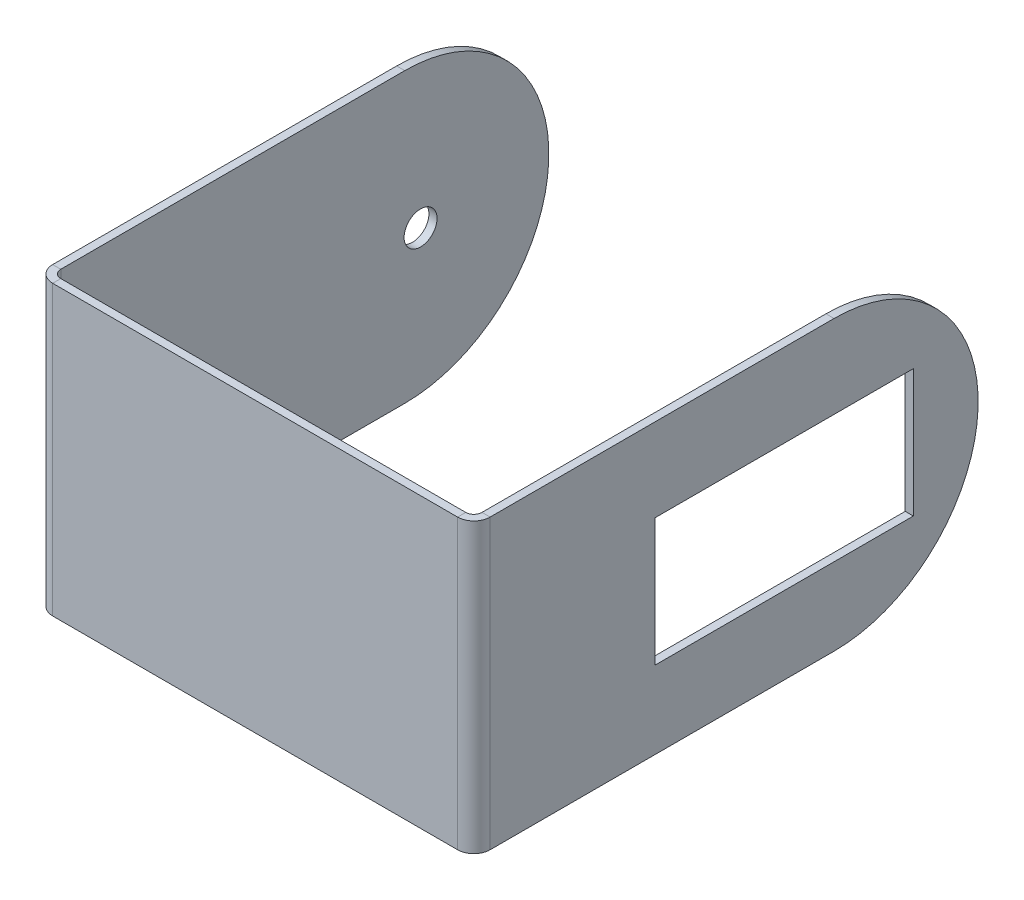
from build123d import *

# Parameters (mm, degrees)
BOSS_EXTRUDE1_DEPTH        = 53.974999999999994
CUT_EXTRUDE1_DEPTH         = 53.974999999999994
CUT_EXTRUDE2_DEPTH         = 40.64
SKETCH4_R                  = 2.0319999999999996
CUT_EXTRUDE3_DEPTH         = 12.699999999999996
CONVERT_SOLID1_DEPTH       = 35.56
CONVERT_SOLID1_START       = 0.640171996
CONVERT_SOLID1_2_OUTLINE_R = 2.032
CONVERT_SOLID1_2_DEPTH     = 0.359828036
CONVERT_SOLID1_START_2     = 52.974999968
CONVERT_SOLID1_3_OUTLINE_W = 15.748000000000001
CONVERT_SOLID1_3_OUTLINE_H = 31.877
CONVERT_SOLID1_3_DEPTH     = 0.241146378
CONVERT_SOLID1_START_3     = 1.000000032
CONVERT_SOLID1_4_OUTLINE_W = 35.56
CONVERT_SOLID1_4_OUTLINE_H = 0.1377071679999986
CONVERT_SOLID1_4_DEPTH     = 51.974999936
CONVERT_SOLID1_5_DEPTH     = 35.56
SCALE1_SCALE               = 1.3


with BuildPart() as part:
    # Sketch1 → Boss-Extrude1 (new body)
    with BuildSketch(Plane(origin=(0, 0, 0), x_dir=(0, 0, -1), z_dir=(1, 0, 0))):
        with BuildLine():
            Line((0, 0), (-44.449999999999996, -5.44e-15))
            Line((-44.449999999999996, -5.44e-15), (-44.449999999999996, 35.55999999999999))
            Line((-44.449999999999996, 35.55999999999999), (0, 35.55999999999999))
            ThreePointArc((0, 35.55999999999999), (17.779999999999994, 17.779999999999994), (0, 0))
        make_face()
    extrude(amount=BOSS_EXTRUDE1_DEPTH)

    # Sketch2 → Cut-Extrude1 (cut)
    with BuildSketch(Plane(origin=(0, 35.55999999999999, 0), x_dir=(1, 0, 0), z_dir=(0, 1, 0))):
        Polygon((0.6401719962352073, 17.998125077829755), (0.6401719962352074, -43.58770713635029), (53.21614634609016, -43.58770713635029), (53.21614634609016, 17.998125077829755), align=None)
    extrude(amount=-CUT_EXTRUDE1_DEPTH, mode=Mode.SUBTRACT)

    # Sketch3 → Cut-Extrude2 (cut)
    with BuildSketch(Plane(origin=(53.974999999999994, 0, 0), x_dir=(0, 0, -1), z_dir=(1, 0, 0))):
        Polygon((-22.098, 25.306389569999986), (9.779, 25.306389569999986), (9.778999999999996, 9.558389569999989), (-22.098, 9.558389569999983), align=None)
    extrude(amount=-CUT_EXTRUDE2_DEPTH, mode=Mode.SUBTRACT)

    # Sketch4 → Cut-Extrude3 (cut)
    with BuildSketch(Plane.ZY):
        with Locations((-1.948939271970541, 17.773350266981094)):
            Circle(SKETCH4_R)
    extrude(amount=-CUT_EXTRUDE3_DEPTH, mode=Mode.SUBTRACT)

    # Convert-Solid1: read off the stored shape, not the designer's step
    # Convert-Solid1 outline → Convert-Solid1 (cut)
    with BuildSketch(Plane(origin=(0, 0, 0), x_dir=(1, 0, 0), z_dir=(0, 1, 0))):
        with BuildLine():
            Line((0, -44.45), (2.000000064, -44.45))
            ThreePointArc((2.000000064, -44.45), (0.585786456, -43.864213544), (0, -42.449999936))
            Line((0, -42.449999936), (0, -44.45))
        make_face()
        with BuildLine():
            Line((53.975, -44.45), (53.975, -42.449999936))
            ThreePointArc((53.975, -42.449999936), (53.389213544, -43.864213544), (51.974999936, -44.45))
            Line((51.974999936, -44.45), (53.975, -44.45))
        make_face()
    extrude(amount=CONVERT_SOLID1_DEPTH, mode=Mode.SUBTRACT)

    # Convert-Solid1 2 outline → Convert-Solid1 2 (add)
    with BuildSketch(Plane.YZ.offset(CONVERT_SOLID1_START)):
        with BuildLine():
            Line((35.56, 43.587707136), (0, 43.587707136))
            Line((0, 43.587707136), (0, 0))
            ThreePointArc((0, 0), (17.78, -17.78), (35.56, 0))
            Line((35.56, 0), (35.56, 43.587707136))
        make_face()
        with Locations((17.773350267, -1.948939272)):
            Circle(CONVERT_SOLID1_2_OUTLINE_R, mode=Mode.SUBTRACT)
    extrude(amount=CONVERT_SOLID1_2_DEPTH)

    # Convert-Solid1 3 outline → Convert-Solid1 3 (add)
    with BuildSketch(Plane.YZ.offset(CONVERT_SOLID1_START_2)):
        with BuildLine():
            Line((35.56, 43.587707136), (0, 43.587707136))
            Line((0, 43.587707136), (0, 0))
            ThreePointArc((0, 0), (17.78, -17.78), (35.56, 0))
            Line((35.56, 0), (35.56, 43.587707136))
        make_face()
        with Locations((17.432389569999998, 6.1594999999999995)):
            Rectangle(CONVERT_SOLID1_3_OUTLINE_W, CONVERT_SOLID1_3_OUTLINE_H, mode=Mode.SUBTRACT)
    extrude(amount=CONVERT_SOLID1_3_DEPTH)

    # Convert-Solid1 4 outline → Convert-Solid1 4 (add)
    with BuildSketch(Plane.YZ.offset(CONVERT_SOLID1_START_3)):
        with Locations((17.78, 43.518853551999996)):
            Rectangle(CONVERT_SOLID1_4_OUTLINE_W, CONVERT_SOLID1_4_OUTLINE_H)
    extrude(amount=CONVERT_SOLID1_4_DEPTH)

    # Convert-Solid1 5 outline → Convert-Solid1 5 (add)
    with BuildSketch(Plane(origin=(0, 0, 0), x_dir=(1, 0, 0), z_dir=(0, 1, 0))):
        with BuildLine():
            Line((1.000000032, -43.449999968), (2.000000064, -43.449999968))
            ThreePointArc((2.000000064, -43.449999968), (1.29289326, -43.15710674), (1.000000032, -42.449999936))
            Line((1.000000032, -42.449999936), (1.000000032, -43.449999968))
        make_face()
        with BuildLine():
            ThreePointArc((52.974999968, -42.449999936), (52.68210674, -43.15710674), (51.974999936, -43.449999968))
            Line((51.974999936, -43.449999968), (52.974999968, -43.449999968))
            Line((52.974999968, -43.449999968), (52.974999968, -42.449999936))
        make_face()
    extrude(amount=CONVERT_SOLID1_5_DEPTH)


with BuildPart() as part_1:
    # Scale1: scaled about (24.607246438, 17.812081852, 25.524433927)
    add(part.part.scale(SCALE1_SCALE).moved(Location((-7.382173931400001, -5.3436245556, -7.657330178100001))))


solid = part_1.part
